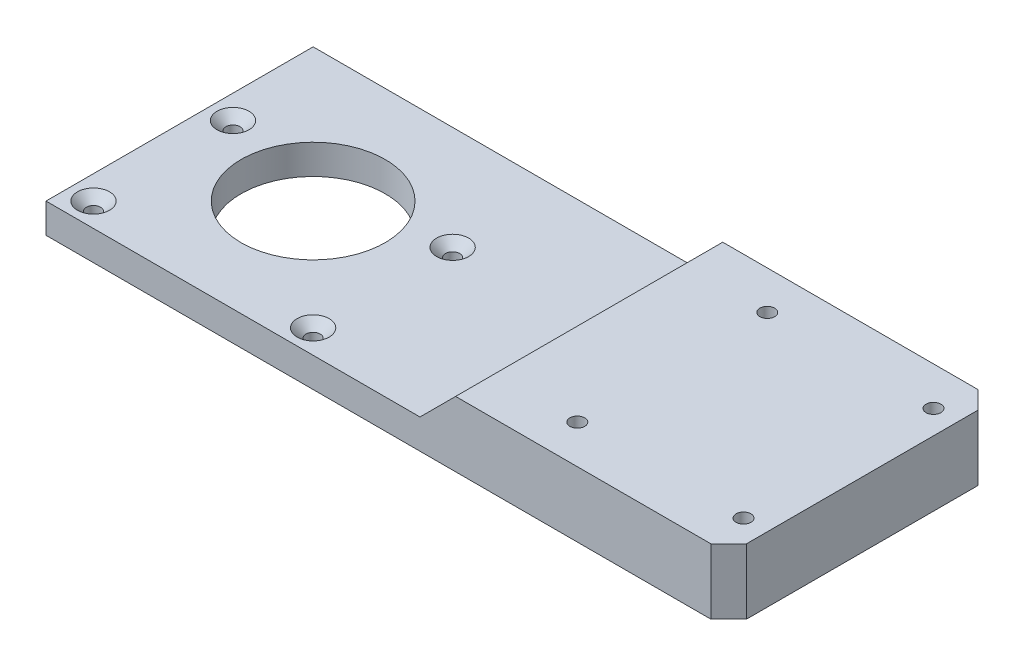
from build123d import *

# Parameters (mm, degrees)
SKETCH1_W                                           = 115
SKETCH1_H                                           = 45
BOSS_EXTRUDE1_DEPTH                                 = 5
CUT_EXTRUDE1_REACH                                  = 119.287
SKETCH2_R                                           = 12.142
CSK_FOR_M2_COUNTERSUNK_FLAT_HEAD_SCREW1_D           = 2.4
CSK_FOR_M2_COUNTERSUNK_FLAT_HEAD_SCREW1_CSINK_D     = 5.4
CSK_FOR_M2_COUNTERSUNK_FLAT_HEAD_SCREW1_CSINK_ANGLE = 90
SKETCH13_W                                          = 52
SKETCH13_H                                          = 45
BOSS_EXTRUDE4_DEPTH                                 = 6
CHAMFER2_SIZE                                       = 6
M3_TAPPED_HOLE1_D                                   = 2.5
CHAMFER1_SIZE                                       = 3


with BuildPart() as part:
    # Sketch1 → Boss-Extrude1 (new body)
    with BuildSketch(Plane(origin=(0, 0, 0), x_dir=(1, 0, 0), z_dir=(0, 1, 0))):
        with Locations((57.5, 0)):
            Rectangle(SKETCH1_W, SKETCH1_H)
    extrude(amount=BOSS_EXTRUDE1_DEPTH)

    # Sketch2 → Cut-Extrude1 (cut, up to next)
    with BuildSketch(Plane(origin=(0, 5, 0), x_dir=(1, 0, 0), z_dir=(0, 1, 0)), mode=Mode.PRIVATE) as cut_extrude1_sk1:
        with Locations(Location((22.5, 0, 0), (0, 0, 270))):
            Circle(SKETCH2_R)
    cut_extrude1_tool1 = extrude(cut_extrude1_sk1.sketch, amount=-CUT_EXTRUDE1_REACH, mode=Mode.PRIVATE) & part.part
    add(cut_extrude1_tool1.solids().sort_by_distance((22.5, 5, 0))[0], mode=Mode.SUBTRACT)

    # CSK for M2 Countersunk Flat Head Screw1 (through all)
    with Locations(Plane(origin=(0, 5, 0), x_dir=(1, 0, 0), z_dir=(0, 1, 0))):
        with Locations((4, -18.5), (41, -18.5), (41, 5), (4, 5)):
            CounterSinkHole(CSK_FOR_M2_COUNTERSUNK_FLAT_HEAD_SCREW1_D / 2, CSK_FOR_M2_COUNTERSUNK_FLAT_HEAD_SCREW1_CSINK_D / 2, counter_sink_angle=CSK_FOR_M2_COUNTERSUNK_FLAT_HEAD_SCREW1_CSINK_ANGLE)

    # Sketch13 → Boss-Extrude4 (add)
    with BuildSketch(Plane(origin=(0, 5, 0), x_dir=(1, 0, 0), z_dir=(0, 1, 0))):
        with Locations((89, 0)):
            Rectangle(SKETCH13_W, SKETCH13_H)
    extrude(amount=BOSS_EXTRUDE4_DEPTH)

    # Chamfer2
    chamfer2_edges = [part.edges().sort_by_distance(p)[0] for p in [
        (63, 11, 0),
    ]]
    chamfer(chamfer2_edges, length=CHAMFER2_SIZE - 0.0001)  # a hair under: the kernel refuses the full size

    # M3 Tapped Hole1 (through all)
    with Locations(Plane(origin=(0, 11, 0), x_dir=(1, 0, 0), z_dir=(0, 1, 0))):
        with Locations((83, 16), (111, 16), (83, -16), (111, -16)):
            Hole(M3_TAPPED_HOLE1_D / 2)

    # Chamfer1
    chamfer1_edges = [part.edges().sort_by_distance(p)[0] for p in [
        (115, 5.5, -22.5),
        (115, 5.5, 22.5),
    ]]
    chamfer(chamfer1_edges, length=CHAMFER1_SIZE)


solid = part.part
